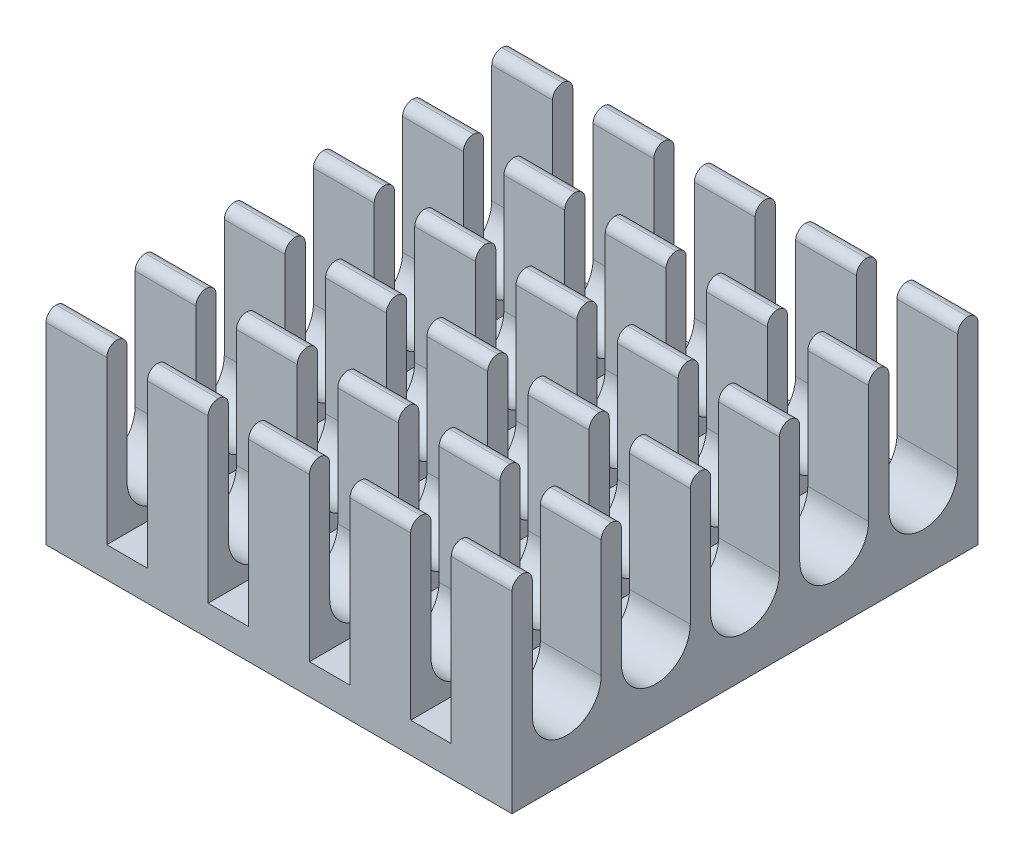
from build123d import *

# Parameters (mm, degrees)
CROQUIS1_W              = 23
CROQUIS1_H              = 23
SALIENTE_EXTRUIR4_DEPTH = 10
CROQUIS2_W              = 2
CROQUIS2_H              = 8.5
CORTAR_EXTRUIR2_DEPTH   = 28.590759323
CORTAR_EXTRUIR6_DEPTH   = 28.590759323
REDONDEO14_R            = 0.5
REDONDEO15_R            = 0.5


with BuildPart() as part:
    # Croquis1 → Saliente-Extruir4 (new body)
    with BuildSketch(Plane(origin=(0, 0, 0), x_dir=(1, 0, 0), z_dir=(0, 1, 0))):
        Rectangle(CROQUIS1_W, CROQUIS1_H)
    extrude(amount=SALIENTE_EXTRUIR4_DEPTH)

    # Croquis2 → Cortar-Extruir2 (cut, through all)
    with BuildSketch(Plane.XY.offset(11.5)):
        with Locations((-7.5, 5.75)):
            Rectangle(CROQUIS2_W, CROQUIS2_H)
        with Locations((-2.5, 5.75)):
            Rectangle(CROQUIS2_W, CROQUIS2_H)
        with Locations((2.5, 5.75)):
            Rectangle(CROQUIS2_W, CROQUIS2_H)
        with Locations((7.5, 5.75)):
            Rectangle(CROQUIS2_W, CROQUIS2_H)
    extrude(amount=-CORTAR_EXTRUIR2_DEPTH, mode=Mode.SUBTRACT)

    # Croquis3 → Cortar-Extruir6 (cut, through all)
    with BuildSketch(Plane(origin=(11.5, 0, 0), x_dir=(0, 0, -1), z_dir=(1, 0, 0))):
        with BuildLine():
            Line((-10.5, 10), (-7.1, 10))
            Line((-7.1, 10), (-7.1, 3.7))
            ThreePointArc((-7.1, 3.7), (-8.8, 2), (-10.5, 3.7))
            Line((-10.5, 3.7), (-10.5, 10))
        make_face()
        with BuildLine():
            Line((-6.1, 10), (-6.1, 3.7))
            ThreePointArc((-6.1, 3.7), (-4.4, 2), (-2.7, 3.7))
            Line((-2.7, 3.7), (-2.7, 10))
            Line((-2.7, 10), (-6.1, 10))
        make_face()
        with BuildLine():
            Line((-1.7, 10), (-1.7, 3.7))
            ThreePointArc((-1.7, 3.7), (0, 2), (1.7, 3.7))
            Line((1.7, 3.7), (1.7, 10))
            Line((1.7, 10), (-1.7, 10))
        make_face()
        with BuildLine():
            Line((2.7, 10), (2.7, 3.7))
            ThreePointArc((2.7, 3.7), (4.4, 2), (6.1, 3.7))
            Line((6.1, 3.7), (6.1, 10))
            Line((6.1, 10), (2.7, 10))
        make_face()
        with BuildLine():
            Line((7.1, 10), (7.1, 3.7))
            ThreePointArc((7.1, 3.7), (8.8, 2), (10.5, 3.7))
            Line((10.5, 3.7), (10.5, 10))
            Line((10.5, 10), (7.1, 10))
        make_face()
    extrude(amount=-CORTAR_EXTRUIR6_DEPTH, mode=Mode.SUBTRACT)

    # Redondeo14
    redondeo14_edges = [part.edges().sort_by_distance(p)[0] for p in [
        (-5, 10, -2.7),
        (-5, 10, -1.7),
        (-10, 10, -2.7),
        (-10, 10, -1.7),
        (-10, 10, 1.7),
        (-10, 10, 2.7),
        (-5, 10, 1.7),
        (-5, 10, 2.7),
        (-5, 10, 6.1),
        (-5, 10, 7.1),
        (-5, 10, 10.5),
        (-5, 10, 11.5),
        (-10, 10, 6.1),
        (-10, 10, 7.1),
        (-10, 10, 10.5),
        (-10, 10, 11.5),
        (0, 10, -2.7),
        (0, 10, -1.7),
        (0, 10, 1.7),
        (0, 10, 2.7),
        (0, 10, 6.1),
        (0, 10, 7.1),
        (0, 10, 10.5),
        (0, 10, 11.5),
        (5, 10, 11.5),
        (5, 10, 10.5),
        (5, 10, 7.1),
        (5, 10, 6.1),
        (5, 10, 2.7),
        (5, 10, 1.7),
        (5, 10, -1.7),
        (5, 10, -2.7),
        (5, 10, -6.1),
        (5, 10, -7.1),
        (0, 10, -6.1),
        (0, 10, -7.1),
        (-5, 10, -6.1),
        (-5, 10, -7.1),
        (-10, 10, -6.1),
        (-10, 10, -7.1),
        (-10, 10, -10.5),
        (-10, 10, -11.5),
        (-5, 10, -10.5),
        (-5, 10, -11.5),
        (0, 10, -11.5),
        (5, 10, -11.5),
        (10, 10, 10.5),
        (10, 10, 11.5),
        (10, 10, 7.1),
        (10, 10, 6.1),
        (10, 10, 2.7),
        (10, 10, 1.7),
        (10, 10, -1.7),
        (10, 10, -2.7),
        (10, 10, -7.1),
        (10, 10, -6.1),
        (10, 10, -10.5),
        (10, 10, -11.5),
    ]]
    fillet(redondeo14_edges, radius=REDONDEO14_R - 0.0001)  # a hair under: the kernel refuses the full size

    # Redondeo15
    redondeo15_edges = [part.edges().sort_by_distance(p)[0] for p in [
        (5, 10, -10.5),
        (0, 10, -10.5),
    ]]
    fillet(redondeo15_edges, radius=REDONDEO15_R)


solid = part.part
